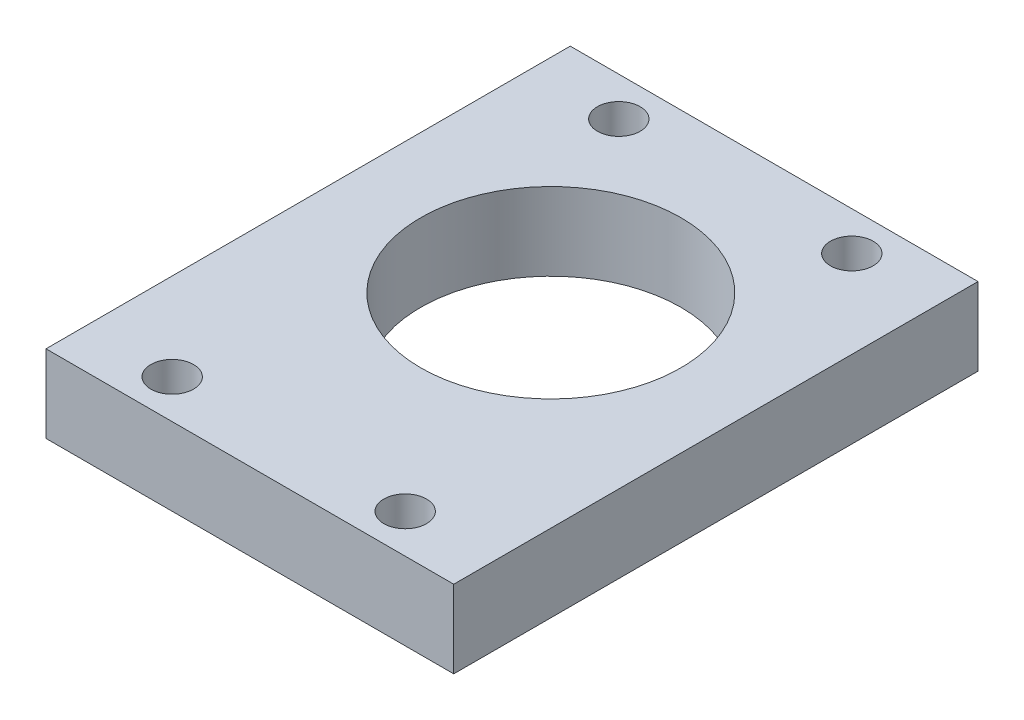
from build123d import *

# Parameters (mm, degrees)
ESQUISSE1_W             = 42
ESQUISSE1_H             = 62
ESQUISSE1_R             = 13.4
BOSS_EXTRU_1_DEPTH      = 8
ENL_V_MAT_EXTRU_2_REACH = 77.313
ESQUISSE3_W             = 42
ESQUISSE3_H             = 8
ESQUISSE2_R             = 2.2
ENL_V_MAT_EXTRU_1_DEPTH = 69.876701431


with BuildPart() as part:
    # Esquisse1 → Boss.-Extru.1 (new body)
    with BuildSketch(Plane(origin=(0, 0, 0), x_dir=(1, 0, 0), z_dir=(0, 1, 0))):
        with Locations((21, 31)):
            Rectangle(ESQUISSE1_W, ESQUISSE1_H)
        with Locations((21, 31)):
            Circle(ESQUISSE1_R, mode=Mode.SUBTRACT)
    extrude(amount=BOSS_EXTRU_1_DEPTH)

    # Esquisse3 → Enlèv. mat.-Extru.2 (cut, up to next)
    with BuildSketch(Plane(origin=(0, 8, 0), x_dir=(1, 0, 0), z_dir=(0, 1, 0)), mode=Mode.PRIVATE) as enl_v_mat_extru_2_sk1:
        with Locations((21, 58)):
            Rectangle(ESQUISSE3_W, ESQUISSE3_H)
    enl_v_mat_extru_2_tool1 = extrude(enl_v_mat_extru_2_sk1.sketch, amount=-ENL_V_MAT_EXTRU_2_REACH, mode=Mode.PRIVATE) & part.part
    add(enl_v_mat_extru_2_tool1.solids().sort_by_distance((21, 8, -58))[0], mode=Mode.SUBTRACT)

    # Esquisse2 → Enlèv. mat.-Extru.1 (cut, through all)
    with BuildSketch(Plane(origin=(0, 8, 0), x_dir=(1, 0, 0), z_dir=(0, 1, 0))):
        with Locations((9, 50)):
            Circle(ESQUISSE2_R)
        with Locations((33, 50)):
            Circle(ESQUISSE2_R)
        with Locations((33, 4)):
            Circle(ESQUISSE2_R)
        with Locations((9, 4)):
            Circle(ESQUISSE2_R)
    extrude(amount=-ENL_V_MAT_EXTRU_1_DEPTH, mode=Mode.SUBTRACT)


solid = part.part
